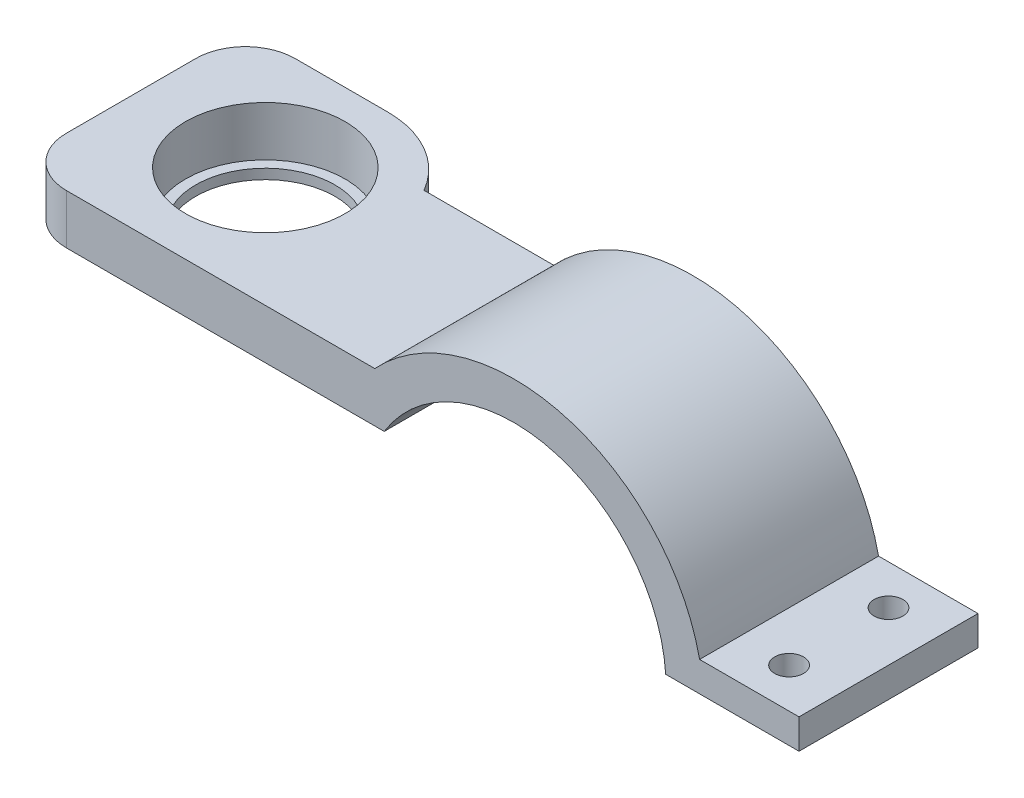
from build123d import *

# Parameters (mm, degrees)
BOSS_EXTRUDE1_DEPTH = 18
SKETCH3_R           = 1.45
CUT_EXTRUDE1_DEPTH  = 56.244999774
SKETCH5_W           = 22.958144304
SKETCH5_H           = 5
BOSS_EXTRUDE2_DEPTH = 5
SKETCH6_R           = 8.025
CUT_EXTRUDE2_DEPTH  = 55.479353888
SKETCH7_R           = 9
SKETCH7_R_2         = 7
BOSS_EXTRUDE3_DEPTH = 1
FILLET1_R           = 5
FILLET2_R           = 10


with BuildPart() as part:
    # Sketch1 → Boss-Extrude1 (new body)
    with BuildSketch(Plane.XY):
        with BuildLine():
            Line((15.267285286, 1), (28.676455767, 1))
            Line((28.676455767, 1), (28.676455767, 4))
            Line((28.676455767, 4), (18.676455767, 4))
            ThreePointArc((18.676455767, 4), (5.072789326, 18.414038353), (-13.99321264, 13))
            Line((-13.99321264, 13), (-50, 13))
            Line((-50, 13), (-50, 8))
            Line((-50, 8), (-13.041855696, 8))
            ThreePointArc((-13.041855696, 8), (3.67261953, 14.852672008), (15.267285286, 1))
        make_face()
    extrude(amount=BOSS_EXTRUDE1_DEPTH)

    # Sketch3 → Cut-Extrude1 (cut, through all)
    with BuildSketch(Plane(origin=(0, 4, 0), x_dir=(1, 0, 0), z_dir=(0, 1, 0))):
        with Locations(Location((23.676455767, -4, 0), (0, 0, 270))):
            Circle(SKETCH3_R)
        with Locations(Location((23.676455767, -14, 0), (0, 0, 270))):
            Circle(SKETCH3_R)
    extrude(amount=-CUT_EXTRUDE1_DEPTH, mode=Mode.SUBTRACT)

    # Sketch5 → Boss-Extrude2 (add)
    with BuildSketch(Plane.XZ.offset(-8)):
        with Locations((-38.520927848, -2.5)):
            Rectangle(SKETCH5_W, SKETCH5_H)
    extrude(amount=-BOSS_EXTRUDE2_DEPTH)

    # Sketch6 → Cut-Extrude2 (cut, through all)
    with BuildSketch(Plane(origin=(0, 13, 0), x_dir=(1, 0, 0), z_dir=(0, 1, 0))):
        with Locations(Location((-37, -6, 0), (0, 0, 180))):
            Circle(SKETCH6_R)
    extrude(amount=-CUT_EXTRUDE2_DEPTH, mode=Mode.SUBTRACT)

    # Sketch7 → Boss-Extrude3 (add)
    with BuildSketch(Plane.XZ.offset(-8)):
        with Locations(Location((-37, 6, 0), (0, 0, 180))):
            Circle(SKETCH7_R)
        with Locations((-37, 6)):
            Circle(SKETCH7_R_2, mode=Mode.SUBTRACT)
    extrude(amount=BOSS_EXTRUDE3_DEPTH)

    # Fillet1
    fillet1_edges = [part.edges().sort_by_distance(p)[0] for p in [
        (-50, 10.5, 18),
        (-50, 10.5, -5),
    ]]
    fillet(fillet1_edges, radius=FILLET1_R)

    # Fillet2
    # the kernel refuses this fillet: 10 mm, written as the material it takes off along each edge
    with BuildSketch(Plane(origin=(-27.041855696, -13.650635095, -5), x_dir=(0, 0, 1), z_dir=(0, 1, 0))) as fillet2_piece_1:
        with BuildLine():
            CenterArc((10, -8.660254038), FILLET2_R, 120, 60)
            Line((0, -8.660254038), (-0.2, -8.660254038))
            Line((-0.2, -8.660254038), (-0.2, 0))
            Line((-0.2, 0), (0, 0.2))
            ThreePointArc((0, 0.2), (2.5, 0.2), (4.9, 0.173205081))
            Line((4.9, 0.173205081), (5, 0))
        make_face()
    extrude(amount=48.301270189, mode=Mode.SUBTRACT)


solid = part.part
